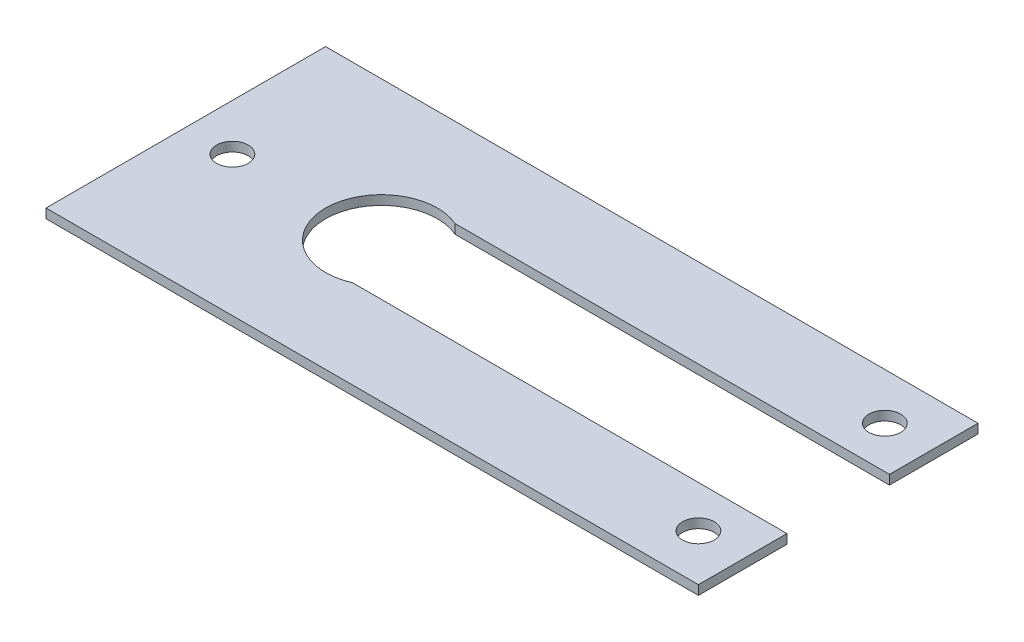
from build123d import *

# Parameters (mm, degrees)
ESQUISSE1_R               = 1.7
T_LE_DE_BASE_PLI_E1_DEPTH = 1


# Sheet-metal steps are written as plain solids
with BuildPart() as part:
    # Esquisse1 → Tôle de base pliée1 (new body)
    with BuildSketch(Plane(origin=(0, 0, 0), x_dir=(1, 0, 0), z_dir=(0, 1, 0))):
        with BuildLine():
            Line((-35, -15), (35, -15))
            Line((35, -15), (35, -5.5))
            Line((35, -5.5), (-11.602084238, -5.5))
            ThreePointArc((-11.602084238, -5.5), (-20, 0), (-11.602084238, 5.5))
            Line((-11.602084238, 5.5), (35, 5.5))
            Line((35, 5.5), (35, 15))
            Line((35, 15), (-35, 15))
            Line((-35, 15), (-35, -15))
        make_face()
        with Locations(Location((30, 10, 0), (0, 0, 270))):
            Circle(ESQUISSE1_R, mode=Mode.SUBTRACT)
        with Locations(Location((30, -10, 0), (0, 0, 90))):
            Circle(ESQUISSE1_R, mode=Mode.SUBTRACT)
        with Locations(Location((-30, 0, 0), (0, 0, 270))):
            Circle(ESQUISSE1_R, mode=Mode.SUBTRACT)
    extrude(amount=-T_LE_DE_BASE_PLI_E1_DEPTH)


solid = part.part
